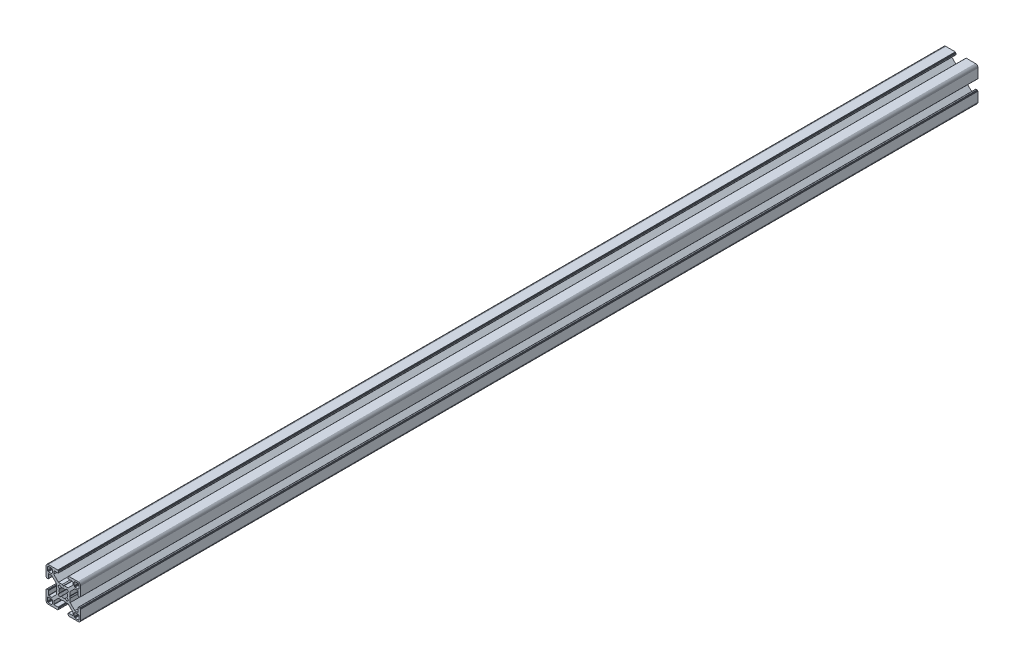
from build123d import *

# Parameters (mm, degrees)
BOSS_EXTRUDE1_DEPTH = 780


with BuildPart() as part:
    # Sketch1 → Boss-Extrude1 (new body)
    with BuildSketch(Plane.XY):
        Polygon((28.34729664, 29.969613999), (28.000000864, 29.999999329), (19.750000909, 29.999999329), (19.715268165, 29.996961355), (19.681595266, 29.987938702), (19.649999216, 29.973205179), (19.621443003, 29.953207821), (19.596790895, 29.928557575), (19.576793537, 29.899999499), (19.562061876, 29.868405312), (19.55303736, 29.834728688), (19.549999386, 29.799999669), (19.549999386, 29.699999839), (19.546961412, 29.665268958), (19.537936896, 29.631596059), (19.523203373, 29.599998146), (19.503207877, 29.571441934), (19.478557631, 29.546789825), (19.449999556, 29.526794329), (19.418403506, 29.512060806), (19.384728745, 29.503038153), (19.349999726, 29.500000179), (19.249999896, 29.500000179), (19.215267517, 29.496958527), (19.181592755, 29.487935874), (19.149996706, 29.47320235), (19.12143863, 29.453206855), (19.096788384, 29.428554746), (19.076791026, 29.399996671), (19.062057503, 29.368402484), (19.05303485, 29.334725859), (19.049996876, 29.299998703), (19.049996876, 28.39999837), (19.059110798, 28.29580945), (19.08618062, 28.194785165), (19.13038119, 28.099997016), (19.190369539, 28.014324653), (19.264324002, 27.94037019), (19.349996366, 27.88038184), (19.444784515, 27.836181271), (19.545806937, 27.809111449), (19.650010894, 27.799984574), (23.050010706, 27.799984574), (23.084741588, 27.7969466), (23.118414487, 27.787923946), (23.150012399, 27.773190423), (23.178568612, 27.753193065), (23.203220721, 27.728542819), (23.223218079, 27.699984744), (23.237949739, 27.668386831), (23.246974255, 27.634713932), (23.25001142, 27.59998608), (23.25001142, 25.049987618), (19.204474482, 20.999982084), (15.900007876, 20.999982084), (15.000008474, 20.48483404), (14.10000814, 20.999982084), (10.795543398, 20.999982084), (7.997342887, 23.801274731), (6.750011387, 25.049984589), (6.750011387, 27.599983051), (6.753049362, 27.634713932), (6.762072946, 27.668386831), (6.776805538, 27.699984744), (6.796801965, 27.728542819), (6.821454073, 27.753193065), (6.850011218, 27.773190423), (6.881607267, 27.787923946), (6.915282029, 27.7969466), (6.950011048, 27.799984574), (10.350011791, 27.799984574), (10.45420071, 27.809098497), (10.555223133, 27.836168318), (10.650011282, 27.880368888), (10.735683645, 27.940357238), (10.809638108, 28.014311701), (10.869626458, 28.099984064), (10.913827027, 28.194772213), (10.940895918, 28.295796498), (10.950010772, 28.399985417), (10.950010772, 29.299985751), (10.946974575, 29.334739239), (10.93795065, 29.368415522), (10.923215933, 29.400009153), (10.903218427, 29.428566473), (10.878566319, 29.45321765), (10.849999264, 29.473204166), (10.818403214, 29.487937689), (10.784728453, 29.496960342), (10.749999434, 29.500000179), (10.649999604, 29.500000179), (10.615270585, 29.503038153), (10.581595823, 29.512060806), (10.549999774, 29.526794329), (10.521441698, 29.546789825), (10.496791452, 29.571441934), (10.476795025, 29.599998146), (10.462061502, 29.631596059), (10.453037918, 29.665268958), (10.449999943, 29.699999839), (10.449999943, 29.799999669), (10.446961969, 29.834728688), (10.437938385, 29.868405312), (10.423205793, 29.899999499), (10.403208435, 29.928557575), (10.378557257, 29.953207821), (10.350000113, 29.973205179), (10.318404064, 29.987938702), (10.284729302, 29.996961355), (10.250000283, 29.999999329), (1.999999397, 29.999999329), (1.652702689, 29.969613999), (1.315958682, 29.879383743), (0.999999233, 29.732050374), (0.714424066, 29.532089829), (0.467910431, 29.285576195), (0.267948955, 28.999999166), (0.120614655, 28.684040532), (0.030384399, 28.34729664), (0, 28.000000864), (0, 19.750000909), (0.003037974, 19.715268165), (0.012061559, 19.681595266), (0.026795082, 19.649999216), (0.046790577, 19.621441141), (0.071442686, 19.596789032), (0.09999983, 19.576793537), (0.13159588, 19.562060013), (0.165270641, 19.55303736), (0.19999966, 19.549999386), (0.299999461, 19.549999386), (0.334728509, 19.546959549), (0.368403242, 19.537936896), (0.399999321, 19.523203373), (0.428556465, 19.503207877), (0.453208573, 19.478555769), (0.473204069, 19.449997693), (0.487937592, 19.418403506), (0.496961176, 19.384728745), (0.499999151, 19.349999726), (0.499999151, 19.249998033), (0.503038056, 19.215269014), (0.512060709, 19.181594253), (0.526794232, 19.150000066), (0.546790194, 19.121441524), (0.571441837, 19.096789882), (0.60000029, 19.076794925), (0.631595686, 19.062061999), (0.665270619, 19.053039982), (0.700000626, 19.050000801), (1.60000096, 19.050000801), (1.704189879, 19.059116587), (1.805213233, 19.086186409), (1.90000045, 19.130385115), (1.985673745, 19.190375328), (2.059627277, 19.264327928), (2.119616325, 19.350002154), (2.163816196, 19.444788441), (2.190886018, 19.545812726), (2.200000872, 19.650001645), (2.200000872, 23.050001457), (2.203039777, 23.084732338), (2.212062431, 23.118405237), (2.226795954, 23.15000315), (2.246792381, 23.178559362), (2.271443558, 23.203211471), (2.300000702, 23.223206967), (2.331596752, 23.23794049), (2.365271513, 23.246965006), (2.400001464, 23.250001117), (4.950000857, 23.250001117), (7.997332093, 20.202670812), (8.995535423, 19.204467788), (8.995535423, 15.900001182), (9.515148227, 15.00000178), (8.995535423, 14.100002378), (8.995535423, 10.795536704), (4.950000857, 6.750002138), (2.400001464, 6.750002138), (2.365271513, 6.753040112), (2.331596752, 6.762063697), (2.300000702, 6.77679722), (2.271443558, 6.796793647), (2.246792381, 6.821444824), (2.226795954, 6.850001968), (2.212062431, 6.881598018), (2.203039777, 6.915272779), (2.200000872, 6.950002729), (2.200000872, 10.350002542), (2.190896812, 10.454174265), (2.16382699, 10.555197618), (2.119627119, 10.649984836), (2.059638071, 10.735658131), (1.985684539, 10.809611663), (1.900011244, 10.869600944), (1.805224027, 10.913800582), (1.704200673, 10.940870404), (1.600011754, 10.949986189), (0.70001142, 10.949986189), (0.665281355, 10.946948596), (0.631606253, 10.937926283), (0.600010578, 10.923193954), (0.571451747, 10.903199537), (0.546799638, 10.87854836), (0.526794232, 10.850000195), (0.512060709, 10.818404146), (0.503038056, 10.784730315), (0.499999151, 10.750000365), (0.499999151, 10.650000535), (0.496961176, 10.615270585), (0.487937592, 10.581596754), (0.473204069, 10.550000705), (0.453208573, 10.521443561), (0.428556465, 10.496791452), (0.399999321, 10.476795956), (0.368403242, 10.462062433), (0.334728509, 10.453038849), (0.299999461, 10.449999943), (0.19999966, 10.449999943), (0.165270641, 10.446961969), (0.13159588, 10.437939316), (0.09999983, 10.423205793), (0.071442686, 10.403209366), (0.046790577, 10.378558189), (0.026795082, 10.350000113), (0.012061559, 10.318404064), (0.003037974, 10.284729302), (0, 10.250000283), (0, 1.999999397), (0.030384399, 1.652702689), (0.120614655, 1.315958682), (0.267948955, 0.999999233), (0.467910431, 0.714424066), (0.714424066, 0.467910431), (0.999999233, 0.267948955), (1.315958682, 0.120614655), (1.652702689, 0.030384399), (1.999999397, 0), (10.250000283, 0), (10.284729302, 0.003037974), (10.318404064, 0.012061559), (10.350000113, 0.026795082), (10.378557257, 0.046790577), (10.403208435, 0.071442686), (10.423205793, 0.09999983), (10.437938385, 0.13159588), (10.446961969, 0.165270641), (10.449999943, 0.19999966), (10.449999943, 0.300000422), (10.453037918, 0.334729441), (10.462061502, 0.368404202), (10.476795025, 0.400000252), (10.496791452, 0.428557396), (10.521441698, 0.453208573), (10.549999774, 0.473205), (10.581595823, 0.487938523), (10.615270585, 0.496961176), (10.649999604, 0.500000082), (10.749999434, 0.500000082), (10.784728453, 0.503038056), (10.818403214, 0.512060709), (10.849999264, 0.526794232), (10.878547894, 0.546800104), (10.903198606, 0.571451747), (10.923194493, 0.6000102), (10.93792742, 0.631606528), (10.946949437, 0.66528146), (10.950010772, 0.699984975), (10.950010772, 1.599985308), (10.940895918, 1.704174228), (10.913827027, 1.805197581), (10.869626458, 1.89998573), (10.809638108, 1.985658094), (10.735683645, 2.059612557), (10.650011282, 2.119600674), (10.555223133, 2.163801476), (10.45420071, 2.190870367), (10.350011791, 2.199985221), (6.950011048, 2.199985221), (6.915282029, 2.203024126), (6.881607267, 2.212046779), (6.850011218, 2.226780302), (6.821454073, 2.246776729), (6.796801965, 2.271427907), (6.776805538, 2.299985982), (6.762072946, 2.331582032), (6.753049362, 2.365256793), (6.750011387, 2.399985812), (6.750011387, 4.949985206), (9.787457566, 7.990785077), (10.795545277, 8.999985833), (14.100010019, 8.999985833), (15.000010353, 9.515133877), (15.900009756, 8.999985833), (19.204476361, 8.999985833), (20.21256413, 7.990786065), (23.25001142, 4.949988235), (23.25001142, 2.399988841), (23.246974255, 2.365256793), (23.237949739, 2.331582032), (23.223218079, 2.299985982), (23.203220721, 2.271427907), (23.178568612, 2.246776729), (23.150012399, 2.226780302), (23.118414487, 2.212046779), (23.084741588, 2.203024126), (23.050010706, 2.199985221), (19.650010894, 2.199985221), (19.545806937, 2.190883319), (19.444784515, 2.163814428), (19.349996366, 2.119613626), (19.264324002, 2.059625509), (19.190369539, 1.985671046), (19.13038119, 1.899998682), (19.08618062, 1.805210533), (19.059110798, 1.70418718), (19.049996876, 1.599998261), (19.049996876, 0.699997927), (19.053035506, 0.665268966), (19.062058795, 0.631594374), (19.076792915, 0.599998603), (19.096790813, 0.571440905), (19.121441524, 0.546790194), (19.149999978, 0.526794306), (19.181596306, 0.51206138), (19.215271238, 0.503039363), (19.249999896, 0.500000082), (19.349999726, 0.500000082), (19.384728745, 0.496961176), (19.418403506, 0.487938523), (19.449999556, 0.473205), (19.478557631, 0.453208573), (19.503207877, 0.428557396), (19.523203373, 0.400000252), (19.537936896, 0.368404202), (19.546961412, 0.334729441), (19.549999386, 0.300000422), (19.549999386, 0.19999966), (19.55303736, 0.165270641), (19.562061876, 0.13159588), (19.576793537, 0.09999983), (19.596789964, 0.071441755), (19.621442072, 0.046789646), (19.649998285, 0.02679415), (19.681594335, 0.012060627), (19.715267234, 0.003037043), (19.750000909, 0), (28.000000864, 0), (28.34729664, 0.030384399), (28.684040532, 0.120614655), (28.999999166, 0.267948955), (29.285576195, 0.467910431), (29.532089829, 0.714424066), (29.732050374, 0.999999233), (29.879383743, 1.315958682), (29.969613999, 1.652702689), (29.999999329, 1.999999397), (29.999999329, 10.250000283), (29.996974806, 10.284715361), (29.987951516, 10.318389952), (29.973217396, 10.349985723), (29.953219499, 10.378543421), (29.928568787, 10.403194133), (29.899999499, 10.423205793), (29.868405312, 10.437939316), (29.834728688, 10.446961969), (29.799999669, 10.449999943), (29.699999839, 10.449999943), (29.664909937, 10.453400043), (29.631233313, 10.462423628), (29.599637263, 10.477157151), (29.57108105, 10.497152646), (29.546427079, 10.521804755), (29.526433446, 10.550361899), (29.511699923, 10.581957949), (29.502675407, 10.615631779), (29.499637433, 10.650361729), (29.499637433, 10.750361559), (29.49697202, 10.784715548), (29.487949367, 10.818389378), (29.473215844, 10.849985428), (29.453220348, 10.878542572), (29.428568239, 10.90319468), (29.400010164, 10.923190176), (29.368415977, 10.937923699), (29.334741215, 10.946947284), (29.300012197, 10.949986189), (28.400011863, 10.949986189), (28.29581215, 10.9408876), (28.194787865, 10.913817778), (28.099999716, 10.86961814), (28.014327352, 10.809628859), (27.940374752, 10.735675327), (27.880384539, 10.650002032), (27.836185833, 10.555214814), (27.809114148, 10.454191461), (27.800000225, 10.350002542), (27.800000225, 6.950002729), (27.796962251, 6.915272779), (27.787939598, 6.881598018), (27.773206075, 6.850001968), (27.753208716, 6.821444824), (27.728558471, 6.796793647), (27.700000395, 6.77679722), (27.668404345, 6.762063697), (27.634729584, 6.753040112), (27.599998702, 6.750002138), (25.05000024, 6.750002138), (23.809199132, 7.99080223), (21.004464477, 10.795534588), (21.004464477, 14.100000262), (20.484851673, 14.999999665), (21.004464477, 15.899999067), (21.004464477, 19.204465672), (25.05000024, 23.250001117), (27.599998702, 23.250001117), (27.634729584, 23.246965006), (27.668404345, 23.23794049), (27.700000395, 23.223206967), (27.728558471, 23.203211471), (27.753208716, 23.178559362), (27.773206075, 23.15000315), (27.787939598, 23.118405237), (27.796962251, 23.084732338), (27.800000225, 23.050001457), (27.800000225, 19.650001645), (27.809114148, 19.545812726), (27.836185833, 19.444788441), (27.880384539, 19.350002154), (27.940370508, 19.264323684), (28.014323108, 19.190371084), (28.099995472, 19.130380872), (28.194783621, 19.086182165), (28.295807906, 19.059112343), (28.400001069, 19.050000801), (29.300001402, 19.050000801), (29.334730421, 19.053040638), (29.368405183, 19.062063291), (29.39999937, 19.076796814), (29.42819671, 19.097149726), (29.452848353, 19.1218023), (29.472843309, 19.150360754), (29.487576235, 19.181955219), (29.496598252, 19.215630151), (29.499637433, 19.250359227), (29.499637433, 19.35036092), (29.502675407, 19.385089939), (29.511699923, 19.4187647), (29.526433446, 19.450358887), (29.546427079, 19.478916963), (29.57108105, 19.503569071), (29.599637263, 19.523564567), (29.631233313, 19.53829809), (29.664909937, 19.547320743), (29.699999839, 19.549999386), (29.799999669, 19.549999386), (29.834728688, 19.55303736), (29.868405312, 19.562060013), (29.899999499, 19.576793537), (29.928557575, 19.596789032), (29.953207821, 19.621441141), (29.973205179, 19.649999216), (29.987938702, 19.681595266), (29.996961355, 19.715268165), (29.999999329, 19.750000909), (29.999999329, 28.000000864), (29.969613999, 28.34729664), (29.879383743, 28.684040532), (29.732050374, 28.999999166), (29.532089829, 29.285576195), (29.285576195, 29.532089829), (28.999999166, 29.732050374), (28.684040532, 29.879383743), align=None)
        Polygon((1.299998723, 25.499999523), (1.299998723, 27.699999511), (1.312309876, 27.856435627), (1.348942518, 28.009016067), (1.408992335, 28.153989464), (1.490981318, 28.287785128), (1.592892222, 28.407108039), (1.71221327, 28.50901708), (1.846008119, 28.591006994), (1.9909814, 28.651056811), (2.143563703, 28.687689453), (2.299998887, 28.699999675), (4.499998875, 28.699999675), (4.656434059, 28.687689453), (4.809016362, 28.651056811), (4.953989759, 28.591006994), (5.087784491, 28.50901708), (5.207106471, 28.407108039), (5.309016444, 28.287785128), (5.391005427, 28.153989464), (5.451056175, 28.009016067), (5.487687886, 27.856435627), (5.499999039, 27.699999511), (5.499999039, 25.499999523), (5.487687886, 25.34356527), (5.451056175, 25.190982968), (5.391005427, 25.04600957), (5.309016444, 24.912213907), (5.207106471, 24.792892858), (5.087784491, 24.690981954), (4.953989759, 24.60899204), (4.809016362, 24.548944086), (4.656434059, 24.512309581), (4.499998875, 24.499999359), (2.299998887, 24.499999359), (2.143563703, 24.512309581), (1.9909814, 24.548944086), (1.846008119, 24.60899204), (1.71221327, 24.690981954), (1.592892222, 24.792892858), (1.490981318, 24.912213907), (1.408992335, 25.04600957), (1.348942518, 25.190982968), (1.312309876, 25.34356527), align=None, mode=Mode.SUBTRACT)
        Polygon((25.34356527, 28.687689453), (25.499999523, 28.699999675), (27.699999511, 28.699999675), (27.856435627, 28.687689453), (28.009017929, 28.651056811), (28.153991327, 28.591006994), (28.28778699, 28.50901708), (28.407108039, 28.407108039), (28.50901708, 28.287785128), (28.591006994, 28.153989464), (28.651056811, 28.009016067), (28.687689453, 27.856435627), (28.700001538, 27.699999511), (28.700001538, 25.499999523), (28.687689453, 25.34356527), (28.651056811, 25.190982968), (28.591006994, 25.04600957), (28.50901708, 24.912213907), (28.407108039, 24.792892858), (28.28778699, 24.690981954), (28.153991327, 24.60899204), (28.009017929, 24.548944086), (27.856435627, 24.512309581), (27.699999511, 24.499999359), (25.499999523, 24.499999359), (25.34356527, 24.512309581), (25.190982968, 24.548944086), (25.04600957, 24.60899204), (24.912215769, 24.690981954), (24.792892858, 24.792892858), (24.690981954, 24.912213907), (24.608993903, 25.04600957), (24.548944086, 25.190982968), (24.512311444, 25.34356527), (24.500001222, 25.499999523), (24.500001222, 27.699999511), (24.512311444, 27.856435627), (24.548944086, 28.009016067), (24.608993903, 28.153989464), (24.690981954, 28.287785128), (24.792892858, 28.407108039), (24.912215769, 28.50901708), (25.04600957, 28.591006994), (25.190982968, 28.651056811), align=None, mode=Mode.SUBTRACT)
        Polygon((14.999999665, 18.649999052), (15.550030395, 18.608318642), (16.087498516, 18.484227359), (16.600128263, 18.280562013), (18.13592948, 19.518401474), (18.644984812, 19.11874488), (19.103571773, 18.662061542), (19.505336881, 18.154669553), (18.280562013, 16.600130126), (18.484227359, 16.087498516), (18.608318642, 15.550030395), (18.649999052, 14.999999665), (18.608318642, 14.449968934), (18.484227359, 13.912500814), (18.280562013, 13.399870135), (19.505336881, 11.845329776), (19.103571773, 11.337937787), (18.644984812, 10.881252587), (18.13592948, 10.481598787), (16.600128263, 11.719437316), (16.087498516, 11.515771039), (15.550030395, 11.391680688), (14.999999665, 11.349999346), (14.449968934, 11.391680688), (13.912500814, 11.515771039), (13.399870135, 11.719437316), (11.864069849, 10.481598787), (11.355013587, 10.881252587), (10.896427557, 11.337937787), (10.494662449, 11.845329776), (11.719438247, 13.399870135), (11.515771039, 13.912500814), (11.391680688, 14.449968934), (11.349999346, 14.999999665), (11.391680688, 15.550030395), (11.515771039, 16.087498516), (11.719438247, 16.600130126), (10.494662449, 18.154669553), (10.896427557, 18.662061542), (11.355013587, 19.11874488), (11.864069849, 19.518401474), (13.399870135, 18.280562013), (13.912500814, 18.484227359), (14.449968934, 18.608318642), align=None, mode=Mode.SUBTRACT)
        Polygon((4.499998875, 1.299999771), (2.299998887, 1.299999771), (2.143563703, 1.312310807), (1.9909814, 1.348942518), (1.846008119, 1.408992335), (1.71221327, 1.490982249), (1.592892222, 1.592892222), (1.490981318, 1.712214202), (1.408992335, 1.846008934), (1.348942518, 1.990982331), (1.312309876, 2.143564634), (1.299998723, 2.299998887), (1.299998723, 4.499999806), (1.312309876, 4.656434059), (1.348942518, 4.809017293), (1.408992335, 4.95399069), (1.490981318, 5.087785423), (1.592892222, 5.207106471), (1.71221327, 5.309017375), (1.846008119, 5.391006358), (1.9909814, 5.451056175), (2.143563703, 5.487688817), (2.299998887, 5.49999997), (4.499998875, 5.49999997), (4.656434059, 5.487688817), (4.809016362, 5.451056175), (4.953989759, 5.391006358), (5.087784491, 5.309017375), (5.207106471, 5.207106471), (5.309016444, 5.087785423), (5.391005427, 4.95399069), (5.451056175, 4.809017293), (5.487687886, 4.656434059), (5.499999039, 4.499999806), (5.499999039, 2.299998887), (5.487687886, 2.143564634), (5.451056175, 1.990982331), (5.391005427, 1.846008934), (5.309016444, 1.712214202), (5.207106471, 1.592892222), (5.087784491, 1.490982249), (4.953989759, 1.408992335), (4.809016362, 1.348942518), (4.656434059, 1.312310807), align=None, mode=Mode.SUBTRACT)
        Polygon((27.699999511, 1.299999771), (25.499999523, 1.299999771), (25.34356527, 1.312310807), (25.190982968, 1.348942518), (25.04600957, 1.408992335), (24.912215769, 1.490982249), (24.792892858, 1.592892222), (24.690981954, 1.712214202), (24.608993903, 1.846008934), (24.548944086, 1.990982331), (24.512311444, 2.143564634), (24.500001222, 2.299998887), (24.500001222, 4.499999806), (24.512311444, 4.656434059), (24.548944086, 4.809017293), (24.608993903, 4.95399069), (24.690981954, 5.087785423), (24.792892858, 5.207106471), (24.912215769, 5.309017375), (25.04600957, 5.391006358), (25.190982968, 5.451056175), (25.34356527, 5.487688817), (25.499999523, 5.49999997), (27.699999511, 5.49999997), (27.856435627, 5.487688817), (28.009017929, 5.451056175), (28.153991327, 5.391006358), (28.28778699, 5.309017375), (28.407108039, 5.207106471), (28.50901708, 5.087785423), (28.591006994, 4.95399069), (28.651056811, 4.809017293), (28.687689453, 4.656434059), (28.700001538, 4.499999806), (28.700001538, 2.299998887), (28.687689453, 2.143564634), (28.651056811, 1.990982331), (28.591006994, 1.846008934), (28.50901708, 1.712214202), (28.407108039, 1.592892222), (28.28778699, 1.490982249), (28.153991327, 1.408992335), (28.009017929, 1.348942518), (27.856435627, 1.312310807), align=None, mode=Mode.SUBTRACT)
    extrude(amount=-BOSS_EXTRUDE1_DEPTH)


solid = part.part
